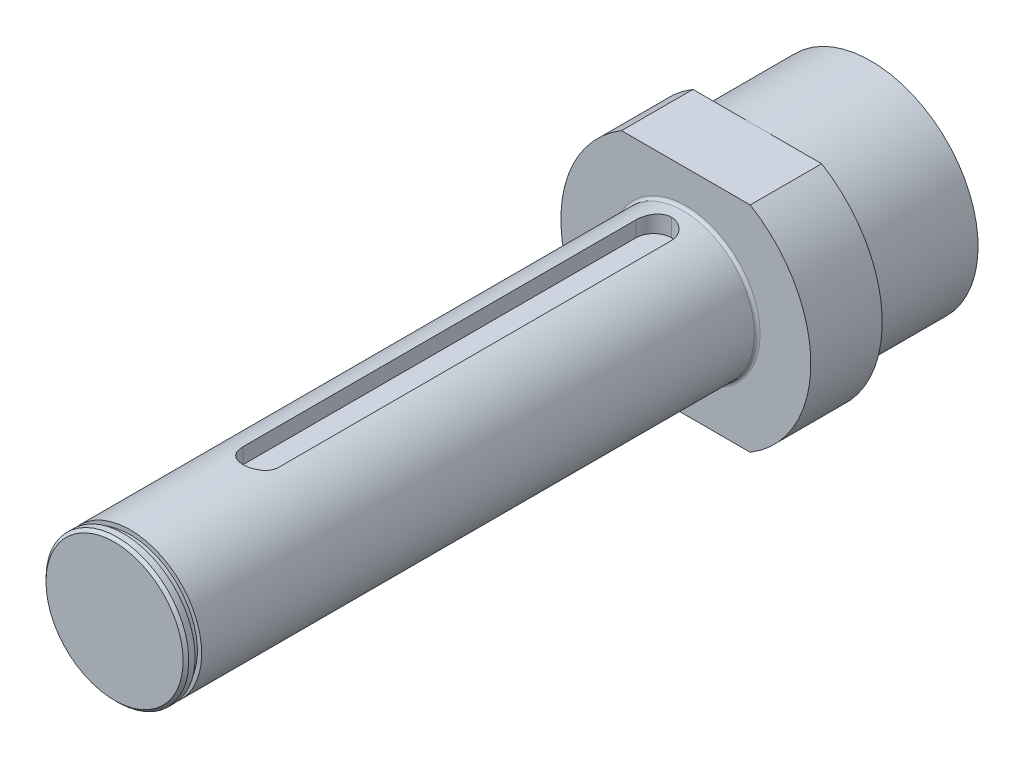
from build123d import *

# Parameters (mm, degrees)
SKETCH1_R           = 19.05
SKETCH1_R_2         = 13.9954
BOSS_EXTRUDE1_DEPTH = 63.5
SKETCH2_R           = 19.05
BOSS_EXTRUDE2_DEPTH = 12.7
SKETCH3_R           = 12.7
BOSS_EXTRUDE3_DEPTH = 127
FILLET1_R           = 0.508
CHAMFER1_SIZE       = 1.27
CUT_EXTRUDE1_DEPTH  = 76.2
FILLET2_R           = 3.175
BOSS_EXTRUDE4_DEPTH = 76.2
BOSS_EXTRUDE5_START = 63.5
SKETCH6_R           = 13.9954
BOSS_EXTRUDE5_DEPTH = 63.5
SKETCH7_R           = 25.219402827
SKETCH7_R_2         = 12.7
CUT_EXTRUDE2_DEPTH  = 63.5
SKETCH8_R           = 14.2875
CUT_EXTRUDE3_DEPTH  = 19.05
SKETCH9_W           = 6.35
SKETCH9_H           = 41.275
CUT_EXTRUDE4_DEPTH  = 25.4
FILLET3_R           = 3.175
SKETCH10_R          = 33.957183176
CUT_EXTRUDE5_DEPTH  = 44.45
SKETCH11_R          = 19.05
SKETCH11_R_2        = 14.986
BOSS_EXTRUDE6_DEPTH = 20.2184
SKETCH12_R          = 18.486840379
CUT_EXTRUDE6_DEPTH  = 25.4
SKETCH13_R          = 16.938517856
SKETCH13_R_2        = 11.938
CUT_EXTRUDE7_DEPTH  = 1.1684
CHAMFER3_SIZE       = 0.508


with BuildPart() as part:
    # Sketch1 → Boss-Extrude1 (new body)
    with BuildSketch(Plane.XY):
        Circle(SKETCH1_R)
        Circle(SKETCH1_R_2, mode=Mode.SUBTRACT)
    extrude(amount=BOSS_EXTRUDE1_DEPTH)

    # Sketch2 → Boss-Extrude2 (add)
    with BuildSketch(Plane.XY.offset(63.5)):
        Circle(SKETCH2_R)
    extrude(amount=BOSS_EXTRUDE2_DEPTH)

    # Sketch3 → Boss-Extrude3 (add)
    with BuildSketch(Plane.XY.offset(76.2)):
        Circle(SKETCH3_R)
    extrude(amount=BOSS_EXTRUDE3_DEPTH)

    # Fillet1
    fillet1_edges = [part.edges().sort_by_distance(p)[0] for p in [
        (-12.7, 0, 76.2),
    ]]
    fillet(fillet1_edges, radius=FILLET1_R)

    # Chamfer1
    chamfer1_edges = [part.edges().sort_by_distance(p)[0] for p in [
        (-12.7, 0, 203.2),
    ]]
    chamfer(chamfer1_edges, length=CHAMFER1_SIZE)

    # Sketch4 → Cut-Extrude1 (cut)
    with BuildSketch(Plane.XY.offset(78.74)):
        with BuildLine():
            Line((-3.175, 9.525), (3.175, 9.525))
            Line((3.175, 9.525), (3.175, 12.296722124))
            ThreePointArc((3.175, 12.296722124), (0, 12.7), (-3.175, 12.296722124))
            Line((-3.175, 12.296722124), (-3.175, 9.525))
        make_face()
    extrude(amount=CUT_EXTRUDE1_DEPTH, mode=Mode.SUBTRACT)

    # Fillet2
    fillet2_edges = [part.edges().sort_by_distance(p)[0] for p in [
        (3.175, 10.910861062, 154.94),
        (-3.175, 10.910861062, 154.94),
        (3.175, 10.910861062, 78.74),
        (-3.175, 10.910861062, 78.74),
    ]]
    fillet(fillet2_edges, radius=FILLET2_R - 0.0001)  # a hair under: the kernel refuses the full size

    # Sketch5 → Boss-Extrude4 (add)
    with BuildSketch(Plane(origin=(0, 0, 0), x_dir=(-1, 0, 0), z_dir=(0, 0, -1))):
        with BuildLine():
            Line((-4.6e-08, 19.05), (-11.4476253, 19.05))
            ThreePointArc((-11.4476253, 19.05), (-22.225, 0), (-11.4476253, -19.05))
            Line((-11.4476253, -19.05), (1.9e-08, -19.05))
            ThreePointArc((1.9e-08, -19.05), (-19.05, -3.2e-08), (-4.6e-08, 19.05))
        make_face()
        with BuildLine():
            Line((11.4476253, 19.05), (-4.6e-08, 19.05))
            ThreePointArc((-4.6e-08, 19.05), (13.470384166, 13.470384198), (19.05, 0))
            ThreePointArc((19.05, 0), (13.470384188, -13.470384175), (1.9e-08, -19.05))
            Line((1.9e-08, -19.05), (11.4476253, -19.05))
            ThreePointArc((11.4476253, -19.05), (19.343915029, -10.943654616), (22.225, 0))
            ThreePointArc((22.225, 0), (19.343915029, 10.943654616), (11.4476253, 19.05))
        make_face()
    extrude(amount=-BOSS_EXTRUDE4_DEPTH)

    # Sketch6 → Boss-Extrude5 (add)
    with BuildSketch(Plane(origin=(0, 0, 63.5), x_dir=(-1, 0, 0), z_dir=(0, 0, -1)).offset(BOSS_EXTRUDE5_START)):
        Circle(SKETCH6_R)
    extrude(amount=-BOSS_EXTRUDE5_DEPTH)

    # Sketch7 → Cut-Extrude2 (cut)
    with BuildSketch(Plane(origin=(0, 0, 0), x_dir=(-1, 0, 0), z_dir=(0, 0, -1))):
        Circle(SKETCH7_R)
        with Locations(Location((0, 0, 0), (0, 0, 180))):
            Circle(SKETCH7_R_2, mode=Mode.SUBTRACT)
    extrude(amount=-CUT_EXTRUDE2_DEPTH, mode=Mode.SUBTRACT)

    # Sketch8 → Cut-Extrude3 (cut)
    with BuildSketch(Plane(origin=(0, 0, 0), x_dir=(-1, 0, 0), z_dir=(0, 0, -1))):
        Circle(SKETCH8_R)
    extrude(amount=-CUT_EXTRUDE3_DEPTH, mode=Mode.SUBTRACT)

    # Sketch9 → Cut-Extrude4 (cut)
    with BuildSketch(Plane(origin=(0, 9.525, 0), x_dir=(1, 0, 0), z_dir=(0, 1, 0))):
        with Locations((0, -39.6875)):
            Rectangle(SKETCH9_W, SKETCH9_H)
    extrude(amount=CUT_EXTRUDE4_DEPTH, mode=Mode.SUBTRACT)

    # Fillet3
    fillet3_edges = [part.edges().sort_by_distance(p)[0] for p in [
        (-3.175, 10.910861062, 60.325),
        (3.175, 10.910861062, 60.325),
    ]]
    fillet(fillet3_edges, radius=FILLET3_R - 0.0001)  # a hair under: the kernel refuses the full size

    # Sketch10 → Cut-Extrude5 (cut)
    with BuildSketch(Plane(origin=(0, 0, 19.05), x_dir=(-1, 0, 0), z_dir=(0, 0, -1))):
        Circle(SKETCH10_R)
    extrude(amount=-CUT_EXTRUDE5_DEPTH, mode=Mode.SUBTRACT)

    # Sketch11 → Boss-Extrude6 (add)
    with BuildSketch(Plane(origin=(0, 0, 63.5), x_dir=(-1, 0, 0), z_dir=(0, 0, -1))):
        with Locations(Location((0, 0, 0), (0, 0, 270))):
            Circle(SKETCH11_R)
        Circle(SKETCH11_R_2, mode=Mode.SUBTRACT)
    extrude(amount=BOSS_EXTRUDE6_DEPTH)

    # Sketch12 → Cut-Extrude6 (cut)
    with BuildSketch(Plane.XY.offset(203.2)):
        Circle(SKETCH12_R)
    extrude(amount=-CUT_EXTRUDE6_DEPTH, mode=Mode.SUBTRACT)

    # Sketch13 → Cut-Extrude7 (cut)
    with BuildSketch(Plane.XY.offset(175.006)):
        Circle(SKETCH13_R)
        Circle(SKETCH13_R_2, mode=Mode.SUBTRACT)
    extrude(amount=CUT_EXTRUDE7_DEPTH, mode=Mode.SUBTRACT)

    # Chamfer3
    chamfer3_edges = [part.edges().sort_by_distance(p)[0] for p in [
        (-12.7, 0, 177.8),
    ]]
    chamfer(chamfer3_edges, length=CHAMFER3_SIZE)


solid = part.part
